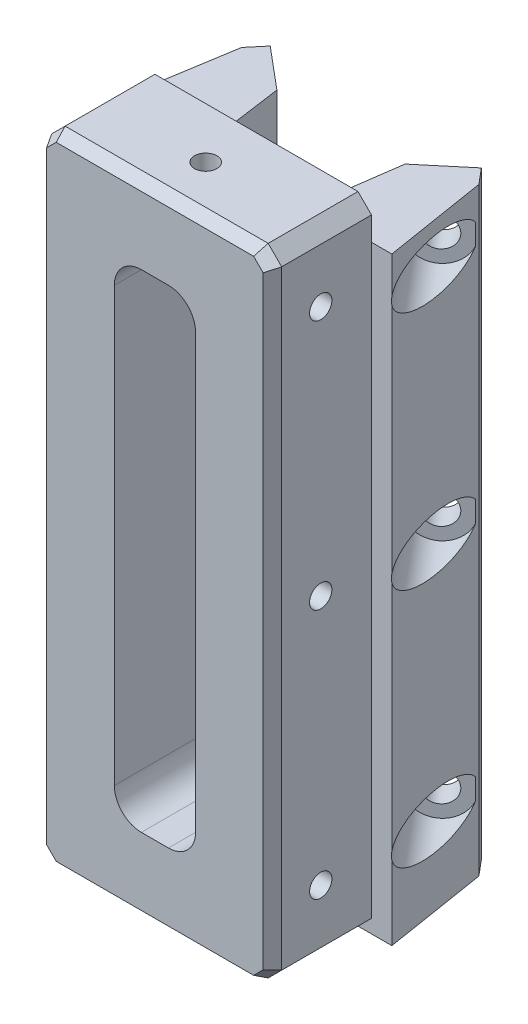
from build123d import *

# Parameters (mm, degrees)
BOSS_EXTRUDE1_DEPTH             = 41.5
BOSS_EXTRUDE1_DEPTH_BACK        = 47
SKETCH2_W                       = 34
SKETCH2_H                       = 94
BOSS_EXTRUDE2_DEPTH             = 15
SKETCH3_W                       = 50
SKETCH3_H                       = 88.5
CUT_EXTRUDE1_DEPTH              = 1
ADVANCEDHOLE1_START             = 0.018666706
ADVANCEDHOLE1_DEPTH             = 12.837085488
ADVANCEDHOLE1_START_2           = -3.481333294
ADVANCEDHOLE1_2_OUTLINE_R       = 2.15
ADVANCEDHOLE1_2_DEPTH           = 3.5
ADVANCEDHOLE2_START             = -11.986045339
ADVANCEDHOLE2_DEPTH             = 11.967378633
ADVANCEDHOLE2_START_2           = -0.018666706
ADVANCEDHOLE2_2_OUTLINE_R       = 2.15
ADVANCEDHOLE2_2_DEPTH           = 3.5
FILLET1_R                       = 4
M4_TAPPED_HOLE1_D               = 3.3
M4_TAPPED_HOLE1_DEPTH           = 9.1
M4_TAPPED_HOLE1_TIP             = 0.991420021
M4_TAPPED_HOLE1_ON_FACE_2_D     = 3.3
M4_TAPPED_HOLE1_ON_FACE_2_DEPTH = 9.1
M4_TAPPED_HOLE1_ON_FACE_2_TIP   = 0.991420021
M4_TAPPED_HOLE1_ON_FACE_3_D     = 3.3
M4_TAPPED_HOLE1_ON_FACE_3_DEPTH = 9.1
M4_TAPPED_HOLE1_ON_FACE_3_TIP   = 0.991420021
M4_TAPPED_HOLE1_ON_FACE_4_D     = 3.3
M4_TAPPED_HOLE1_ON_FACE_4_DEPTH = 9.1
M4_TAPPED_HOLE1_ON_FACE_4_TIP   = 0.991420021
CHAMFER1_SIZE                   = 2
CHAMFER2_SIZE                   = 1
CHAMFER2_SIZE2                  = 1.732050808
CUT_EXTRUDE2_REACH              = 62.613


# Read off the part's stored shape, not the designer's step: AdvancedHole1, AdvancedHole2
with BuildPart() as part:
    # Sketch1 → Boss-Extrude1 (new, two sides: drawn at the far end of the back side and taken through both)
    with BuildSketch(Plane(origin=(0, 0, 0), x_dir=(1, 0, 0), z_dir=(0, 1, 0)).offset(-BOSS_EXTRUDE1_DEPTH_BACK)):
        Polygon((17, 0), (20, 0), (17.52689899, 15.335150469), (15.598536161, 17.633283798), (9.470180616, 12.49098292), (8, 2), (-8, 2), (-9.470180616, 12.49098292), (-15.598536161, 17.633283798), (-17.52689899, 15.335150469), (-20, 0), (-17, 0), align=None)
    extrude(amount=BOSS_EXTRUDE1_DEPTH + BOSS_EXTRUDE1_DEPTH_BACK)

    # Sketch2 → Boss-Extrude2 (add)
    with BuildSketch(Plane.XY):
        Rectangle(SKETCH2_W, SKETCH2_H)
    extrude(amount=BOSS_EXTRUDE2_DEPTH)

    # Sketch3 → Cut-Extrude1 (cut)
    with BuildSketch(Plane.XY):
        with Locations((-42, -2.75)):
            Rectangle(SKETCH3_W, SKETCH3_H)
    extrude(amount=-CUT_EXTRUDE1_DEPTH, mode=Mode.SUBTRACT)

    # AdvancedHole1 outline → AdvancedHole1 (cut)
    with BuildSketch(Plane(origin=(0, 0, 0), x_dir=(0.7660444431189763, 0, -0.6427876096865414), z_dir=(0.6427876096865414, 0, 0.7660444431189763)).offset(ADVANCEDHOLE1_START)):
        with BuildLine():
            Line((22.985109569, 33.983742651), (23.606222085, 35.5))
            Line((23.606222085, 35.5), (22.985109569, 37.016257349))
            ThreePointArc((22.985109569, 37.016257349), (15.283628291, 35.5), (22.985109569, 33.983742651))
        make_face()
        with BuildLine():
            Line((22.985109569, -37.016257349), (23.606222085, -35.5))
            Line((23.606222085, -35.5), (22.985109569, -33.983742651))
            ThreePointArc((22.985109569, -33.983742651), (15.283628291, -35.5), (22.985109569, -37.016257349))
        make_face()
        with BuildLine():
            ThreePointArc((22.985109569, 1.516257349), (15.283628291, 0), (22.985109569, -1.516257349))
            Line((22.985109569, -1.516257349), (23.606222085, 0))
            Line((23.606222085, 0), (22.985109569, 1.516257349))
        make_face()
    extrude(amount=ADVANCEDHOLE1_DEPTH, mode=Mode.SUBTRACT)

    # AdvancedHole1 2 outline → AdvancedHole1 2 (cut)
    with BuildSketch(Plane(origin=(0, 0, 0), x_dir=(0.7660444431189763, 0, -0.6427876096865414), z_dir=(0.6427876096865414, 0, 0.7660444431189763)).offset(ADVANCEDHOLE1_START_2)):
        with Locations((19.283628291, 0)):
            Circle(ADVANCEDHOLE1_2_OUTLINE_R)
        with Locations((19.283628291, -35.5)):
            Circle(ADVANCEDHOLE1_2_OUTLINE_R)
        with Locations((19.283628291, 35.5)):
            Circle(ADVANCEDHOLE1_2_OUTLINE_R)
    extrude(amount=ADVANCEDHOLE1_2_DEPTH, mode=Mode.SUBTRACT)

    # AdvancedHole2 outline → AdvancedHole2 (cut)
    with BuildSketch(Plane(origin=(0, 0, 0), x_dir=(0.7660444431189767, 0, 0.6427876096865409), z_dir=(0.6427876096865409, 0, -0.7660444431189768)).offset(ADVANCEDHOLE2_START)):
        with BuildLine():
            Line((-23.606222085, 35.5), (-22.985109569, 33.983742651))
            ThreePointArc((-22.985109569, 33.983742651), (-15.283628291, 35.5), (-22.985109569, 37.016257349))
            Line((-22.985109569, 37.016257349), (-23.606222085, 35.5))
        make_face()
        with BuildLine():
            Line((-22.985109569, 1.516257349), (-23.606222085, 0))
            Line((-23.606222085, 0), (-22.985109569, -1.516257349))
            ThreePointArc((-22.985109569, -1.516257349), (-15.283628291, 0), (-22.985109569, 1.516257349))
        make_face()
        with BuildLine():
            Line((-22.985109569, -33.983742651), (-23.606222085, -35.5))
            Line((-23.606222085, -35.5), (-22.985109569, -37.016257349))
            ThreePointArc((-22.985109569, -37.016257349), (-15.283628291, -35.5), (-22.985109569, -33.983742651))
        make_face()
    extrude(amount=ADVANCEDHOLE2_DEPTH, mode=Mode.SUBTRACT)

    # AdvancedHole2 2 outline → AdvancedHole2 2 (cut)
    with BuildSketch(Plane(origin=(0, 0, 0), x_dir=(0.7660444431189767, 0, 0.6427876096865409), z_dir=(0.6427876096865409, 0, -0.7660444431189768)).offset(ADVANCEDHOLE2_START_2)):
        with Locations((-19.283628291, 35.5)):
            Circle(ADVANCEDHOLE2_2_OUTLINE_R)
        with Locations((-19.283628291, 0)):
            Circle(ADVANCEDHOLE2_2_OUTLINE_R)
        with Locations((-19.283628291, -35.5)):
            Circle(ADVANCEDHOLE2_2_OUTLINE_R)
    extrude(amount=ADVANCEDHOLE2_2_DEPTH, mode=Mode.SUBTRACT)

    # Fillet1
    fillet1_edges = [part.edges().sort_by_distance(p)[0] for p in [
        (-8, -2.75, -2),
        (8, -2.75, -2),
    ]]
    fillet(fillet1_edges, radius=FILLET1_R)

    # M4 Tapped Hole1
    with Locations(Plane(origin=(0, -47, 7.5), x_dir=(0, 0, -1), z_dir=(0, -1, 0))):
        with Locations((0, 0)):
            Hole(M4_TAPPED_HOLE1_D / 2, depth=M4_TAPPED_HOLE1_DEPTH)
            with Locations((0, 0, -(M4_TAPPED_HOLE1_DEPTH + M4_TAPPED_HOLE1_TIP / 2))):  # 118° drill point
                Cone(0, M4_TAPPED_HOLE1_D / 2, M4_TAPPED_HOLE1_TIP, mode=Mode.SUBTRACT)

    # M4 Tapped Hole1 on face 2
    with Locations(Plane(origin=(17, 37, 7.5), x_dir=(0, 0, 1), z_dir=(1, 0, 0))):
        with Locations((0, 0), (0, 74), (0, 37)):
            Hole(M4_TAPPED_HOLE1_ON_FACE_2_D / 2, depth=M4_TAPPED_HOLE1_ON_FACE_2_DEPTH)
            with Locations((0, 0, -(M4_TAPPED_HOLE1_ON_FACE_2_DEPTH + M4_TAPPED_HOLE1_ON_FACE_2_TIP / 2))):  # 118° drill point
                Cone(0, M4_TAPPED_HOLE1_ON_FACE_2_D / 2, M4_TAPPED_HOLE1_ON_FACE_2_TIP, mode=Mode.SUBTRACT)

    # M4 Tapped Hole1 on face 3
    with Locations(Plane(origin=(-17, -37, 7.5), x_dir=(0, 0, -1), z_dir=(-1, 0, 0))):
        with Locations((0, 0), (0, -74), (0, -37)):
            Hole(M4_TAPPED_HOLE1_ON_FACE_3_D / 2, depth=M4_TAPPED_HOLE1_ON_FACE_3_DEPTH)
            with Locations((0, 0, -(M4_TAPPED_HOLE1_ON_FACE_3_DEPTH + M4_TAPPED_HOLE1_ON_FACE_3_TIP / 2))):  # 118° drill point
                Cone(0, M4_TAPPED_HOLE1_ON_FACE_3_D / 2, M4_TAPPED_HOLE1_ON_FACE_3_TIP, mode=Mode.SUBTRACT)

    # M4 Tapped Hole1 on face 4
    with Locations(Plane(origin=(0, 47, 7.5), x_dir=(0, 0, 1), z_dir=(0, 1, 0))):
        with Locations((0, 0)):
            Hole(M4_TAPPED_HOLE1_ON_FACE_4_D / 2, depth=M4_TAPPED_HOLE1_ON_FACE_4_DEPTH)
            with Locations((0, 0, -(M4_TAPPED_HOLE1_ON_FACE_4_DEPTH + M4_TAPPED_HOLE1_ON_FACE_4_TIP / 2))):  # 118° drill point
                Cone(0, M4_TAPPED_HOLE1_ON_FACE_4_D / 2, M4_TAPPED_HOLE1_ON_FACE_4_TIP, mode=Mode.SUBTRACT)

    # Chamfer1
    chamfer1_edges = [part.edges().sort_by_distance(p)[0] for p in [
        (17, -47, 7.5),
        (17, 47, 7.5),
        (-17, 47, 7.5),
        (-17, -47, 7),
    ]]
    chamfer(chamfer1_edges, length=CHAMFER1_SIZE)

    # Chamfer2
    chamfer2_edges = [part.edges().sort_by_distance(p)[0] for p in [
        (17, 0, 15),
        (0, -47, 15),
        (0, 47, 15),
        (-17, 0, 15),
        (-16, 46, 15),
        (16, 46, 15),
        (-16, -46, 15),
        (16, -46, 15),
    ]]
    chamfer2_side = [part.faces().sort_by_distance(p)[0] for p in [
        (0, 0, 15),
    ]]
    chamfer(chamfer2_edges, length=CHAMFER2_SIZE, length2=CHAMFER2_SIZE2, reference=chamfer2_side[0])

    # Sketch9 → Cut-Extrude2 (cut, up to next)
    with BuildSketch(Plane.XY.offset(15), mode=Mode.PRIVATE) as cut_extrude2_sk1:
        with BuildLine():
            Line((-6, 32), (-6, -32))
            ThreePointArc((-6, -32), (-4.828427125, -34.828427125), (-2, -36))
            Line((-2, -36), (2, -36))
            ThreePointArc((2, -36), (4.828427125, -34.828427125), (6, -32))
            Line((6, -32), (6, 32))
            ThreePointArc((6, 32), (4.828427125, 34.828427125), (2, 36))
            Line((2, 36), (-2, 36))
            ThreePointArc((-2, 36), (-4.828427125, 34.828427125), (-6, 32))
        make_face()
    cut_extrude2_tool1 = extrude(cut_extrude2_sk1.sketch, amount=-CUT_EXTRUDE2_REACH, mode=Mode.PRIVATE) & part.part
    add(cut_extrude2_tool1.solids().sort_by_distance((0, 0, 15))[0], mode=Mode.SUBTRACT)


solid = part.part
